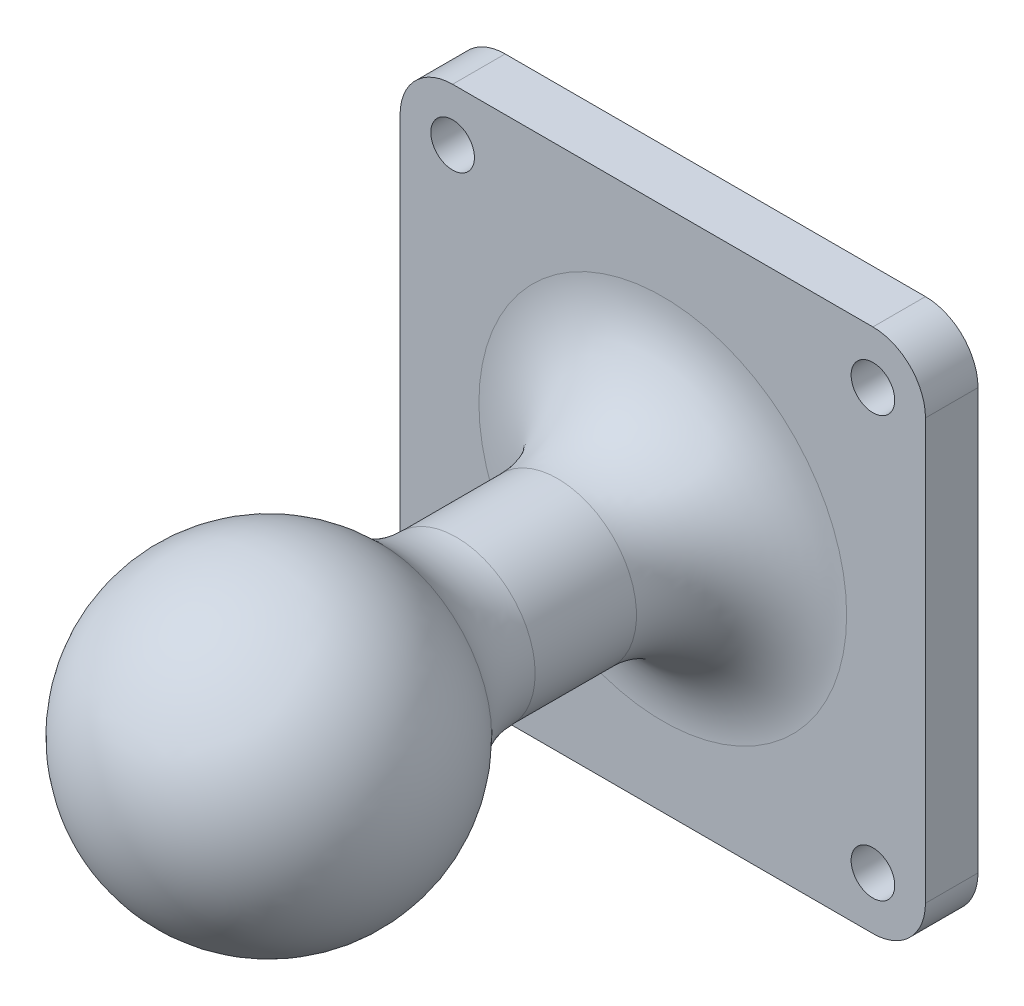
from build123d import *

# Parameters (mm, degrees)
CROQUIS1_W                   = 50
CROQUIS1_H                   = 50
SALIENTE_EXTRUIR1_DEPTH      = 5
SALIENTE_EXTRUIR2_REACH      = 65.295
SALIENTE_EXTRUIR2_END_RADIUS = 15
CROQUIS2_R                   = 7.5
CROQUIS4_R                   = 1.5
CORTAR_EXTRUIR1_DEPTH        = 5
REDONDEO1_R                  = 5
SKETCH1_R                    = 2.075
CUT_EXTRUDE1_DEPTH           = 10
REDONDEO2_R                  = 10


with BuildPart() as part:
    # Croquis1 → Saliente-Extruir1 (new body)
    with BuildSketch(Plane.XY):
        Rectangle(CROQUIS1_W, CROQUIS1_H)
    extrude(amount=SALIENTE_EXTRUIR1_DEPTH)



with BuildPart() as body_2:
    # Croquis3 → Revolución1 (revolve)
    with BuildSketch(Plane.XY.offset(42.5)):
        with BuildLine():
            Line((0, 15), (0, -15))
            ThreePointArc((0, -15), (15, 0), (0, 15))
        make_face()
    revolve(axis=Axis((0, 15, 42.5), (0, -1, 0)))


with BuildPart() as part_1:
    add(part.part)

    add(body_2.part)  # Saliente-Extruir2 merges body 2
    # Saliente-Extruir2: up to this sphere (the profile starts outside it)
    saliente_extruir2_end = Location((0, 0, 42.5)) * Sphere(SALIENTE_EXTRUIR2_END_RADIUS, mode=Mode.PRIVATE)
    # Croquis2 → Saliente-Extruir2 (add, up to the surface)
    with BuildSketch(Plane.XY.offset(5), mode=Mode.PRIVATE) as saliente_extruir2_sk1:
        Circle(CROQUIS2_R)
    saliente_extruir2_tool1 = extrude(saliente_extruir2_sk1.sketch, amount=SALIENTE_EXTRUIR2_REACH, mode=Mode.PRIVATE) - saliente_extruir2_end
    add(saliente_extruir2_tool1.solids().sort_by_distance((0, 0, 5))[0])

    # Croquis4 → Cortar-Extruir1 (cut)
    with BuildSketch(Plane.XY.offset(5)):
        with Locations((-20, 20)):
            Circle(CROQUIS4_R)
        with Locations((20, 20)):
            Circle(CROQUIS4_R)
        with Locations((20, -20)):
            Circle(CROQUIS4_R)
        with Locations((-20, -20)):
            Circle(CROQUIS4_R)
    extrude(amount=-CORTAR_EXTRUIR1_DEPTH, mode=Mode.SUBTRACT)

    # Redondeo1
    redondeo1_edges = [part_1.edges().sort_by_distance(p)[0] for p in [
        (25, -25, 2.5),
        (25, 25, 2.5),
        (-25, 25, 2.5),
        (-25, -25, 2.5),
    ]]
    fillet(redondeo1_edges, radius=REDONDEO1_R)

    # Sketch1 → Cut-Extrude1 (cut)
    with BuildSketch(Plane.XY.offset(5)):
        with Locations((-20, 20)):
            Circle(SKETCH1_R)
        with Locations((20, 20)):
            Circle(SKETCH1_R)
        with Locations((20, -20)):
            Circle(SKETCH1_R)
        with Locations((-20, -20)):
            Circle(SKETCH1_R)
    extrude(amount=-CUT_EXTRUDE1_DEPTH, mode=Mode.SUBTRACT)

    # Redondeo2
    redondeo2_edges = [part_1.edges().sort_by_distance(p)[0] for p in [
        (-7.5, 0, 29.509618943),
        (-7.5, 0, 5),
    ]]
    fillet(redondeo2_edges, radius=REDONDEO2_R)


solid = part_1.part
